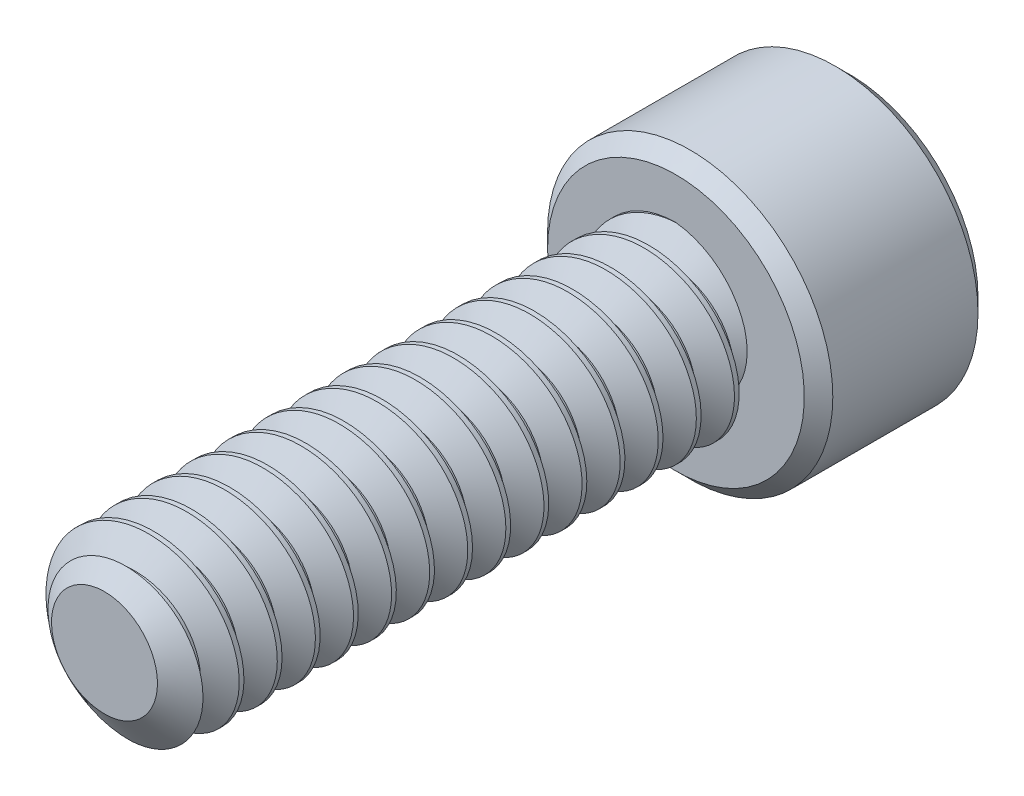
from build123d import *

# Parameters (mm, degrees)
SKETCH1_R          = 2.413
EXTRUDE1_DEPTH     = 15.875
CUT_SWEEP1_PITCH   = 1.058333333
SKETCH6_R          = 3.9624
EXTRUDE2_DEPTH     = 4.826
CUT_EXTRUDE1_DEPTH = 2.9765625
CHAMFER1_SIZE      = 0.39624


with BuildPart() as part:
    # Sketch1 → Extrude1 (new body)
    with BuildSketch(Plane.XY):
        Circle(SKETCH1_R)
    extrude(amount=-EXTRUDE1_DEPTH)

    # Cut-Sweep1: the profile of Sketch3 profile screwed along a right-hand helix of 16 turns, 6 arcs to a turn; built about Z, then put on its axis
    cut_sweep1_z = Axis((0, 0, 0), (0, 0, 1))
    cut_sweep1_corners = [(2.4133, 0, -0.926214872), (1.725592336, 0, -0.529166667), (1.725592336, 0, -0.396875), (2.4133, 0, 0.000173205)]
    with BuildLine(mode=Mode.PRIVATE) as cut_sweep1_profile:
        Line(cut_sweep1_corners[0], cut_sweep1_corners[1])
        Line(cut_sweep1_corners[1], cut_sweep1_corners[2])
        Line(cut_sweep1_corners[2], cut_sweep1_corners[3])
        Line(cut_sweep1_corners[3], cut_sweep1_corners[0])
    cut_sweep1_cap = Face(cut_sweep1_profile.wire())
    cut_sweep1_turn_angles = [0, 30, 60, 90, 120, 150, 180, 210, 240, 270, 300, 330, 360]
    cut_sweep1_turn_weights = [1, 0.8660254037844387, 1, 0.8660254037844387, 1, 0.8660254037844387, 1, 0.8660254037844387, 1, 0.8660254037844387, 1, 0.8660254037844387, 1]
    cut_sweep1_turn_rails = [Edge.make_bspline([Vector(p[0], p[1], 0).rotate(cut_sweep1_z, cut_sweep1_turn_angles[k]) / cut_sweep1_turn_weights[k] + Vector(0, 0, p[2] + CUT_SWEEP1_PITCH * cut_sweep1_turn_angles[k] / 360) for k in range(13)], [0, 0, 0, 1, 1, 2, 2, 3, 3, 4, 4, 5, 5, 6, 6, 6], 2, cut_sweep1_turn_weights) for p in cut_sweep1_corners]
    cut_sweep1_turn_sides = [Face.make_surface_from_curves(cut_sweep1_turn_rails[p[0]], cut_sweep1_turn_rails[p[1]]) for p in [(0, 1), (1, 2), (2, 3), (3, 0)]]
    cut_sweep1 = Plane(origin=(0, 0, 0), x_dir=(0, 1, 0), z_dir=(0, 0, -1)) * Solid(Shell([*[p.moved(Location((0, 0, CUT_SWEEP1_PITCH * i))) for i in range(16) for p in cut_sweep1_turn_sides], cut_sweep1_cap, cut_sweep1_cap.rotate(cut_sweep1_z, 5760).moved(Location((0, 0, CUT_SWEEP1_PITCH * 5760 / 360)))]))
    add(cut_sweep1, mode=Mode.SUBTRACT)

    # Sketch4 → Cut-Revolve1 (revolve, cut)
    with BuildSketch(Plane(origin=(0, 0, 0), x_dir=(0, 0, -1), z_dir=(1, 0, 0)), mode=Mode.PRIVATE) as cut_revolve1_sk:
        Polygon((0.659180743, 2.413), (0, 1.471592336), (0, 2.413), align=None)
    revolve(cut_revolve1_sk.sketch.rotate(Axis((0, 0, 0), (0, 0, -1)), 240.547545651), axis=Axis((0, 0, 0), (0, 0, -1)), mode=Mode.SUBTRACT)

    # Sketch6 → Extrude2 (add)
    with BuildSketch(Plane(origin=(0, 0, -15.875), x_dir=(-1, 0, 0), z_dir=(0, 0, -1))):
        Circle(SKETCH6_R)
    extrude(amount=EXTRUDE2_DEPTH)

    # Sketch7 → Cut-Extrude1 (cut)
    with BuildSketch(Plane(origin=(0, 0, -20.701), x_dir=(-1, 0, 0), z_dir=(0, 0, -1))):
        Polygon((0, 2.291358881), (-1.984375, 1.14567944), (-1.984375, -1.14567944), (0, -2.291358881), (1.984375, -1.14567944), (1.984375, 1.14567944), align=None)
    extrude(amount=-CUT_EXTRUDE1_DEPTH, mode=Mode.SUBTRACT)

    # Cut-Extrude2 cone 1 section (through the dimple's axis) → Cut-Extrude2 (revolve, cut)
    with BuildSketch(Plane(origin=(0, 0, -20.701), x_dir=(0, 1, 0), z_dir=(1, 0, 0))):
        Polygon((0, 0), (2.291358881, 0), (0, 2.291358881), align=None)
    revolve(axis=Axis((0, 0, -20.701), (0, 0, 1)), mode=Mode.SUBTRACT)

    # Chamfer1
    chamfer1_edges = [part.edges().sort_by_distance(p)[0] for p in [
        (3.9624, 0, -15.875),
        (3.9624, 0, -20.701),
    ]]
    chamfer(chamfer1_edges, length=CHAMFER1_SIZE)


solid = part.part
